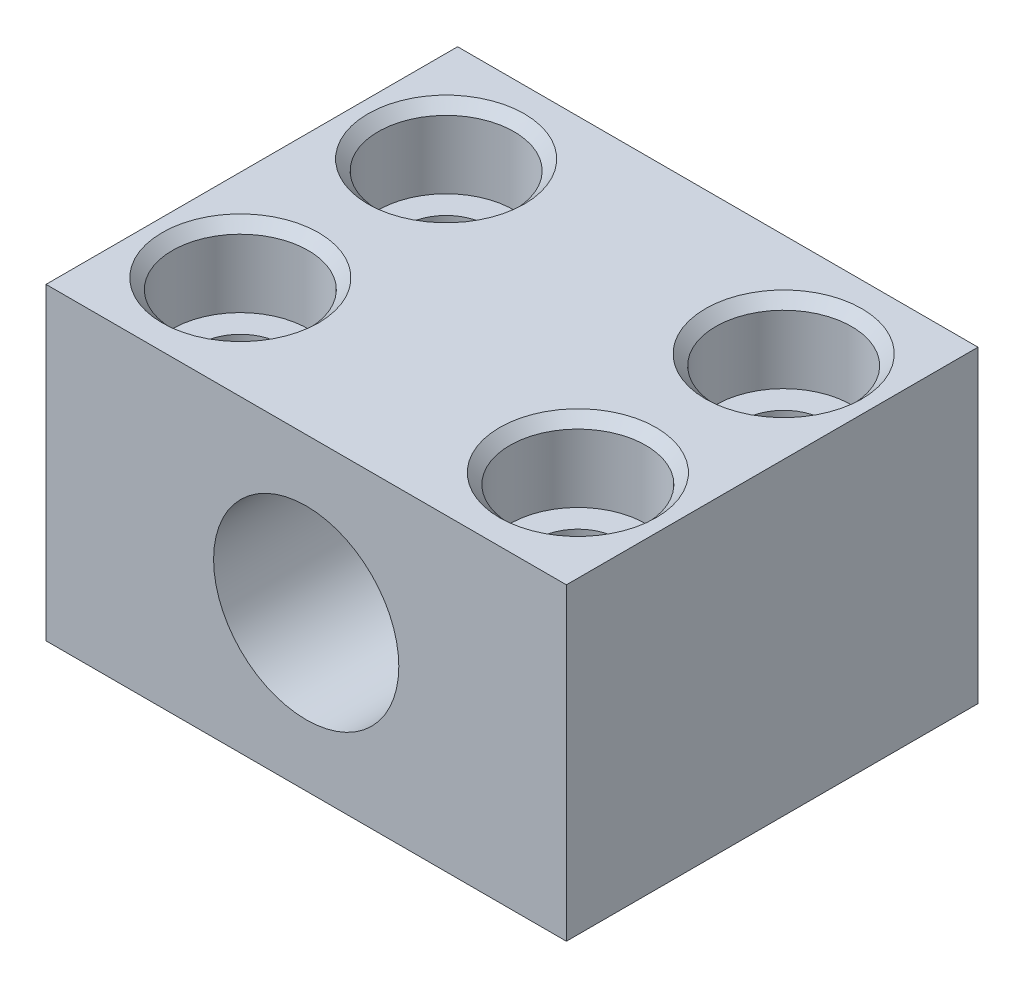
from build123d import *

# Parameters (mm, degrees)
SKETCH1_R                                    = 18.669
SKETCH1_R_2                                  = 5.715
NUT_BODY_EXTRUDE_DEPTH                       = 25.4
NUT_TRIM_CUT_EXTRUDE_DEPTH                   = 37.636363384
CBORE_FOR_10_SOCKET_HEAD_CAP_SCREW1_AT_COUNT = 2
CBORE_FOR_10_SOCKET_HEAD_CAP_SCREW1_AT_PITCH = 12.7
CBORE_FOR_10_SOCKET_HEAD_CAP_SCREW1_2_COUNT  = 2
CBORE_FOR_10_SOCKET_HEAD_CAP_SCREW1_2_PITCH  = 24.394581038
CBORE_FOR_10_SOCKET_HEAD_CAP_SCREW1_3_COUNT  = 2
CBORE_FOR_10_SOCKET_HEAD_CAP_SCREW1_3_PITCH  = 20.828


with BuildPart() as part:
    # Sketch1 → nut-body-extrude (new body)
    with BuildSketch(Plane.XY):
        Circle(SKETCH1_R)
        Circle(SKETCH1_R_2, mode=Mode.SUBTRACT)
    extrude(amount=NUT_BODY_EXTRUDE_DEPTH)

    # Sketch2 → nut-trim-cut-extrude (cut, through all)
    with BuildSketch(Plane.XY):
        with BuildLine():
            ThreePointArc((16.056336319, 9.525), (0, 18.669), (-16.056336319, 9.525))
            Line((-16.056336319, 9.525), (16.056336319, 9.525))
        make_face()
        with BuildLine():
            Line((-16.056336319, -9.525), (-16.056336319, 9.525))
            ThreePointArc((-16.056336319, 9.525), (-18.669, 0), (-16.056336319, -9.525))
        make_face()
        with BuildLine():
            ThreePointArc((16.056336319, -9.525), (18.669, 0), (16.056336319, 9.525))
            Line((16.056336319, 9.525), (16.056336319, -9.525))
        make_face()
        with BuildLine():
            Line((16.056336319, -9.525), (-16.056336319, -9.525))
            ThreePointArc((-16.056336319, -9.525), (0, -18.669), (16.056336319, -9.525))
        make_face()
    extrude(amount=NUT_TRIM_CUT_EXTRUDE_DEPTH, mode=Mode.SUBTRACT)

    # Sketch4 → CBORE for #10 Socket Head Cap Screw1 (revolve, cut)
    with BuildSketch(Plane(origin=(10.414, 9.525, 6.35), x_dir=(0, 0, 1), z_dir=(1, 0, 0))):
        Polygon((0, 0), (0, 19.05), (2.5527, 19.05), (2.5527, 4.826), (4.191, 4.826), (4.191, 0.635), (4.826, 0), align=None)
    cbore_for_10_socket_head_cap_screw1 = revolve(axis=Axis((10.414, 15.875, 6.35), (0, -1, 0)), mode=Mode.SUBTRACT)

    # CBORE for #10 Socket Head Cap Screw1 at: CBORE for #10 Socket Head Cap Screw1 ×2
    with Locations(*[(0, 0, i * CBORE_FOR_10_SOCKET_HEAD_CAP_SCREW1_AT_PITCH) for i in range(1, CBORE_FOR_10_SOCKET_HEAD_CAP_SCREW1_AT_COUNT)]):
        add(cbore_for_10_socket_head_cap_screw1, mode=Mode.SUBTRACT)

    # CBORE for _10 Socket Head Cap Screw1 2: CBORE for #10 Socket Head Cap Screw1 ×2
    with Locations(*[Vector(-0.8537961757940361, 0, 0.5206074242646559) * (i * CBORE_FOR_10_SOCKET_HEAD_CAP_SCREW1_2_PITCH) for i in range(1, CBORE_FOR_10_SOCKET_HEAD_CAP_SCREW1_2_COUNT)]):
        add(cbore_for_10_socket_head_cap_screw1, mode=Mode.SUBTRACT)

    # CBORE for _10 Socket Head Cap Screw1 3: CBORE for #10 Socket Head Cap Screw1 ×2
    with Locations(*[(-i * CBORE_FOR_10_SOCKET_HEAD_CAP_SCREW1_3_PITCH, 0, 0) for i in range(1, CBORE_FOR_10_SOCKET_HEAD_CAP_SCREW1_3_COUNT)]):
        add(cbore_for_10_socket_head_cap_screw1, mode=Mode.SUBTRACT)


solid = part.part
